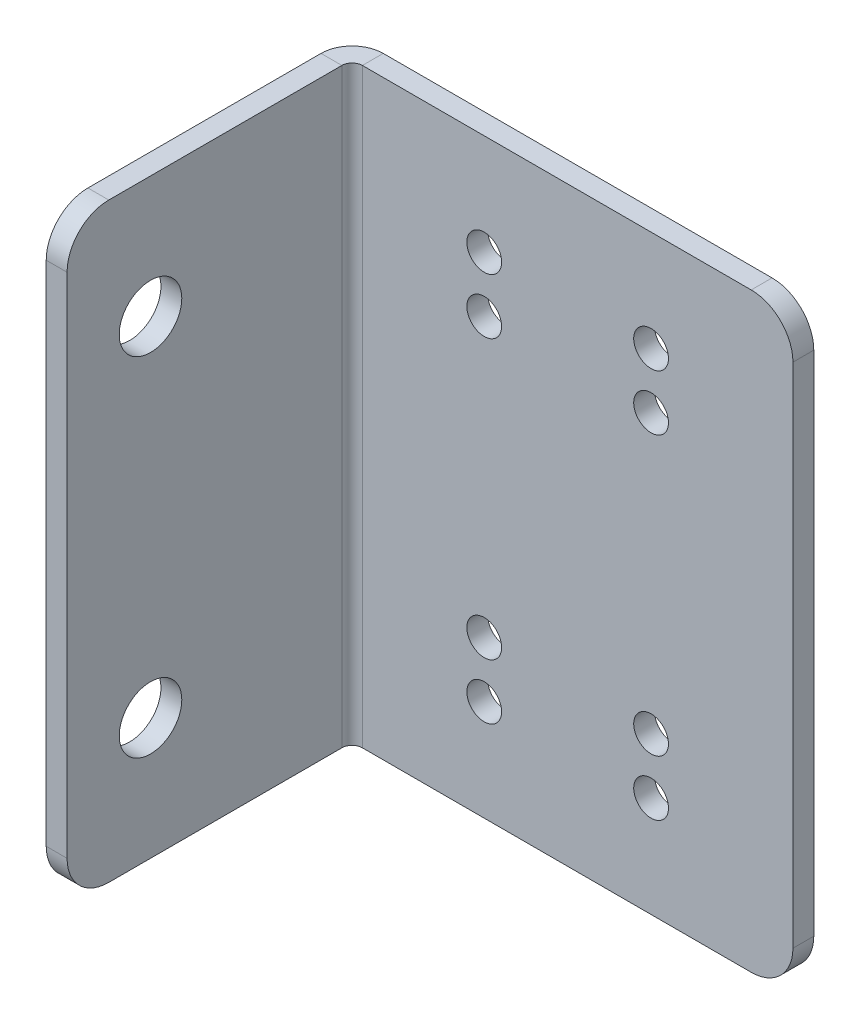
from build123d import *

# Parameters (mm, degrees)
SKETCH_1_W                       = 33.2
SKETCH_1_H                       = 42.5
SM_BASE_FLANGE_1_DEPTH           = 1.5
SM_EDGE_FLANGE_1_STRIP_W         = 7.4732
SM_EDGE_FLANGE_1_STRIP_H         = 1.5
SM_EDGE_FLANGE_1_STRIP_CUT_DEPTH = 42.5
SM_EDGE_FLANGE_1_DEPTH           = 42.5
SKETCH_9_R                       = 1.25
CUT_EXTRUDE_1_DEPTH              = 10
SKETCH_10_R                      = 2.25
CUT_EXTRUDE_2_DEPTH              = 10
FILLET_1_R                       = 3


# Sheet-metal steps are written as plain solids
with BuildPart() as part:
    # Sketch 1 → 基体-法兰1 (new body)
    with BuildSketch(Plane.XY):
        Rectangle(SKETCH_1_W, SKETCH_1_H)
    extrude(amount=-SM_BASE_FLANGE_1_DEPTH)

    # 边线-法兰1 strip (across the edge) → 边线-法兰1 strip cut (cut)
    with BuildSketch(Plane(origin=(-16.6, 21.25, 0), x_dir=(1, 0, 0), z_dir=(0, -1, 0))):
        with Locations((-1.5, -0.75)):
            Rectangle(SM_EDGE_FLANGE_1_STRIP_W, SM_EDGE_FLANGE_1_STRIP_H)
    extrude(amount=SM_EDGE_FLANGE_1_STRIP_CUT_DEPTH, mode=Mode.SUBTRACT)

    # 边线-法兰1 section (across the edge) → 边线-法兰1 (add)
    with BuildSketch(Plane(origin=(-16.6, 21.25, 0), x_dir=(1, 0, 0), z_dir=(0, -1, 0))):
        with BuildLine():
            Line((0, 0.7366), (0, 20.5))
            Line((0, 20.5), (1.5, 20.5))
            Line((1.5, 20.5), (1.5, 0.7366))
            ThreePointArc((1.5, 0.7366), (1.715745145, 0.215745145), (2.2366, 0))
            Line((2.2366, 0), (2.2366, -1.5))
            ThreePointArc((2.2366, -1.5), (0.655084973, -0.844915027), (0, 0.7366))
        make_face()
    extrude(amount=SM_EDGE_FLANGE_1_DEPTH)

    # 草图9 → 切除-拉伸1 (cut)
    with BuildSketch(Plane.XY):
        with Locations((6.4, 14)):
            Circle(SKETCH_9_R)
        with Locations((-5.6, 14)):
            Circle(SKETCH_9_R)
        with Locations((6.4, -10)):
            Circle(SKETCH_9_R)
        with Locations((-5.6, -10)):
            Circle(SKETCH_9_R)
    cut_extrude_1 = extrude(amount=-CUT_EXTRUDE_1_DEPTH, mode=Mode.SUBTRACT)

    # 草图10 → 切除-拉伸2 (cut)
    with BuildSketch(Plane(origin=(-15.1, 0, 0), x_dir=(0, 0, -1), z_dir=(1, 0, 0))):
        with Locations((-14.5, 12.5)):
            Circle(SKETCH_10_R)
        with Locations((-14.5, -12.5)):
            Circle(SKETCH_10_R)
    extrude(amount=-CUT_EXTRUDE_2_DEPTH, mode=Mode.SUBTRACT)

    # 镜向1: 切除-拉伸1 across plane
    add(cut_extrude_1.mirror(Plane.ZX), mode=Mode.SUBTRACT)

    # 圆角1
    fillet_1_edges = [part.edges().sort_by_distance(p)[0] for p in [
        (-15.85, 21.25, 20.5),
        (-15.85, -21.25, 20.5),
        (16.6, 21.25, -0.75),
        (16.6, -21.25, -0.75),
    ]]
    fillet(fillet_1_edges, radius=FILLET_1_R)


solid = part.part
